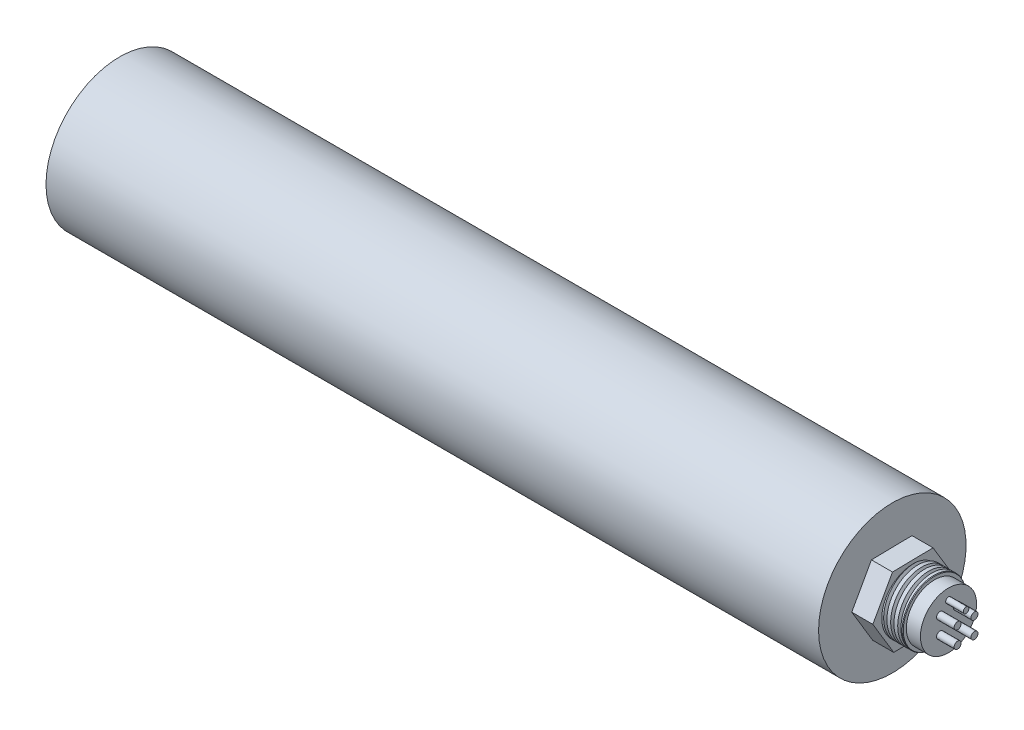
from build123d import *

# Parameters (mm, degrees)
BOSS_EXTRUDE1_DEPTH = 7.62
SKETCH4_R           = 10.16
BOSS_EXTRUDE2_DEPTH = 12.7
SKETCH5_R           = 11.43
SKETCH5_R_2         = 10.16
EXTRUDE_THIN1_DEPTH = 7.62
CHAMFER2_SIZE       = 0.254
CHAMFER2_SIZE2      = 0.146646968
CUT_SWEEP4_PITCH    = 2.54
CUT_SWEEP4_TO       = 7.62
SKETCH10_R          = 26.67
BOSS_EXTRUDE3_DEPTH = 279.4
SKETCH11_R          = 1.27
BOSS_EXTRUDE4_DEPTH = 6.35
SKETCH12_R          = 1.27
BOSS_EXTRUDE5_DEPTH = 6.35
SKETCH13_R          = 1.27
BOSS_EXTRUDE6_DEPTH = 6.35
SKETCH14_R          = 1.27
BOSS_EXTRUDE7_DEPTH = 6.35
SKETCH16_R          = 1.016
BOSS_EXTRUDE8_DEPTH = 6.35
SKETCH17_R          = 26.67
BOSS_EXTRUDE9_DEPTH = 127


with BuildPart() as part:
    # Sketch3 → Boss-Extrude1 (new body)
    with BuildSketch(Plane(origin=(0, 0, 0), x_dir=(0, 0, -1), z_dir=(1, 0, 0))):
        Polygon((14.662463333, 0.255934249), (7.109586105, 12.826032853), (-7.552877228, 12.570098604), (-14.662463333, -0.255934249), (-7.109586105, -12.826032853), (7.552877228, -12.570098604), align=None)
    extrude(amount=BOSS_EXTRUDE1_DEPTH)

    # Sketch4 → Boss-Extrude2 (add)
    with BuildSketch(Plane(origin=(7.62, 0, 0), x_dir=(0, 0, -1), z_dir=(1, 0, 0))):
        Circle(SKETCH4_R)
    extrude(amount=BOSS_EXTRUDE2_DEPTH)

    # Sketch5 → Extrude-Thin1 (add)
    with BuildSketch(Plane(origin=(7.62, 0, 0), x_dir=(0, 0, -1), z_dir=(1, 0, 0))):
        Circle(SKETCH5_R)
        Circle(SKETCH5_R_2, mode=Mode.SUBTRACT)
    extrude(amount=EXTRUDE_THIN1_DEPTH)

    # Chamfer2
    chamfer2_edges = [part.edges().sort_by_distance(p)[0] for p in [
        (15.24, 0, 11.43),
    ]]
    chamfer2_side = [part.faces().sort_by_distance(p)[0] for p in [
        (11.43, 0, 11.43),
    ]]
    chamfer(chamfer2_edges, length=CHAMFER2_SIZE, length2=CHAMFER2_SIZE2, reference=chamfer2_side[0])

    # Cut-Sweep4: arcs per turn and ends read off the stored shape
    # Cut-Sweep4: the profile of Sketch9 screwed along a right-hand helix through 3.6 turns, 10 arcs to a turn; built about Z, then put on its axis
    cut_sweep4_z = Axis((0, 0, 0), (0, 0, 1))
    cut_sweep4_corners = [(10.414, 0, 0), (11.938, 0, -0.87988181), (11.938, 0, 0.87988181)]
    with BuildLine(mode=Mode.PRIVATE) as cut_sweep4_profile:
        Line(cut_sweep4_corners[0], cut_sweep4_corners[1])
        Line(cut_sweep4_corners[1], cut_sweep4_corners[2])
        Line(cut_sweep4_corners[2], cut_sweep4_corners[0])
    cut_sweep4_cap = Face(cut_sweep4_profile.wire())
    cut_sweep4_turn_angles = [0, 18, 36, 54, 72, 90, 108, 126, 144, 162, 180, 198, 216, 234, 252, 270, 288, 306, 324, 342, 360]
    cut_sweep4_turn_weights = [1, 0.9510565162951535, 1, 0.9510565162951535, 1, 0.9510565162951535, 1, 0.9510565162951535, 1, 0.9510565162951535, 1, 0.9510565162951535, 1, 0.9510565162951535, 1, 0.9510565162951535, 1, 0.9510565162951535, 1, 0.9510565162951535, 1]
    cut_sweep4_turn_rails = [Edge.make_bspline([Vector(p[0], p[1], 0).rotate(cut_sweep4_z, cut_sweep4_turn_angles[k]) / cut_sweep4_turn_weights[k] + Vector(0, 0, p[2] + CUT_SWEEP4_PITCH * cut_sweep4_turn_angles[k] / 360) for k in range(21)], [0, 0, 0, 1, 1, 2, 2, 3, 3, 4, 4, 5, 5, 6, 6, 7, 7, 8, 8, 9, 9, 10, 10, 10], 2, cut_sweep4_turn_weights) for p in cut_sweep4_corners]
    cut_sweep4_turn_sides = [Face.make_surface_from_curves(cut_sweep4_turn_rails[p[0]], cut_sweep4_turn_rails[p[1]]) for p in [(0, 1), (1, 2), (2, 0)]]
    cut_sweep4_last_angles = [1080, 1098, 1116, 1134, 1152, 1170, 1188, 1206, 1224, 1242, 1260, 1278, 1296]
    cut_sweep4_last_weights = [1, 0.9510565162951535, 1, 0.9510565162951535, 1, 0.9510565162951535, 1, 0.9510565162951535, 1, 0.9510565162951535, 1, 0.9510565162951535, 1]
    cut_sweep4_last_rails = [Edge.make_bspline([Vector(p[0], p[1], 0).rotate(cut_sweep4_z, cut_sweep4_last_angles[k]) / cut_sweep4_last_weights[k] + Vector(0, 0, p[2] + CUT_SWEEP4_PITCH * cut_sweep4_last_angles[k] / 360) for k in range(13)], [0, 0, 0, 1, 1, 2, 2, 3, 3, 4, 4, 5, 5, 6, 6, 6], 2, cut_sweep4_last_weights) for p in cut_sweep4_corners]
    cut_sweep4_last_sides = [Face.make_surface_from_curves(cut_sweep4_last_rails[p[0]], cut_sweep4_last_rails[p[1]]) for p in [(0, 1), (1, 2), (2, 0)]]
    cut_sweep4 = Plane(origin=(15.24, 0, 0), x_dir=(0, 0, -1), z_dir=(-1, 0, 0)) * split(Solid(Shell([*[p.moved(Location((0, 0, CUT_SWEEP4_PITCH * i))) for i in range(3) for p in cut_sweep4_turn_sides], *cut_sweep4_last_sides, cut_sweep4_cap, cut_sweep4_cap.rotate(cut_sweep4_z, 1296).moved(Location((0, 0, CUT_SWEEP4_PITCH * 1296 / 360)))])), bisect_by=Plane.XY.offset(CUT_SWEEP4_TO), keep=Keep.BOTTOM, mode=Mode.PRIVATE)
    add(cut_sweep4, mode=Mode.SUBTRACT)

    # Sketch10 → Boss-Extrude3 (add)
    with BuildSketch(Plane.ZY):
        Circle(SKETCH10_R)
    extrude(amount=BOSS_EXTRUDE3_DEPTH)

    # Sketch11 → Boss-Extrude4 (add)
    with BuildSketch(Plane(origin=(20.32, 0, 0), x_dir=(0, 0, -1), z_dir=(1, 0, 0))):
        with Locations((-3.048, 3.048)):
            Circle(SKETCH11_R)
    extrude(amount=BOSS_EXTRUDE4_DEPTH)

    # Sketch12 → Boss-Extrude5 (add)
    with BuildSketch(Plane(origin=(20.32, 0, 0), x_dir=(0, 0, -1), z_dir=(1, 0, 0))):
        with Locations((3.048, 3.048)):
            Circle(SKETCH12_R)
    extrude(amount=BOSS_EXTRUDE5_DEPTH)

    # Sketch13 → Boss-Extrude6 (add)
    with BuildSketch(Plane(origin=(20.32, 0, 0), x_dir=(0, 0, -1), z_dir=(1, 0, 0))):
        with Locations((3.048, -3.048)):
            Circle(SKETCH13_R)
    extrude(amount=BOSS_EXTRUDE6_DEPTH)

    # Sketch14 → Boss-Extrude7 (add)
    with BuildSketch(Plane(origin=(20.32, 0, 0), x_dir=(0, 0, -1), z_dir=(1, 0, 0))):
        with Locations((-3.048, -3.048)):
            Circle(SKETCH14_R)
    extrude(amount=BOSS_EXTRUDE7_DEPTH)

    # Sketch16 → Boss-Extrude8 (add)
    with BuildSketch(Plane(origin=(20.32, 0, 0), x_dir=(0, 0, -1), z_dir=(1, 0, 0))):
        with Locations((0, 6.35)):
            Circle(SKETCH16_R)
    extrude(amount=BOSS_EXTRUDE8_DEPTH)

    # Sketch17 → Boss-Extrude9 (add)
    with BuildSketch(Plane(origin=(0, 0, 0), x_dir=(0, 0, -1), z_dir=(1, 0, 0))):
        with Locations(Location((0, 0, 0), (0, 0, 180))):
            Circle(SKETCH17_R)
    extrude(amount=-BOSS_EXTRUDE9_DEPTH)


solid = part.part
